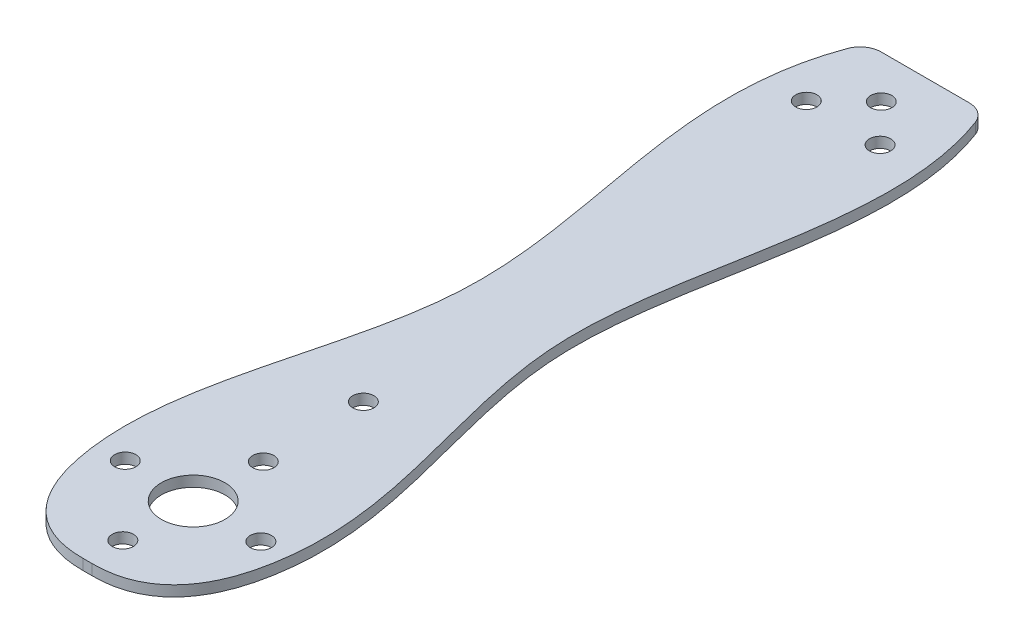
from build123d import *

# Parameters (mm, degrees)
BOSS_EXTRUDE2_DEPTH = 1.27
SKETCH2_R           = 1.27
CUT_EXTRUDE1_DEPTH  = 90.688856727
F_3DSKETCH1_R       = 1.27
F_3DSKETCH1_R_2     = 3.81
CUT_EXTRUDE8_DEPTH  = 81.499781524
SKETCH4_R           = 1.27
CUT_EXTRUDE9_DEPTH  = 90.688856727


with BuildPart() as part:
    # Sketch1 → Boss-Extrude2 (new body)
    with BuildSketch(Plane(origin=(0, 0, 0), x_dir=(1, 0, 0), z_dir=(0, 1, 0))):
        with BuildLine():
            Line((5.275230634, 88.9), (-5.274680514, 88.9))
            ThreePointArc((-5.274680514, 88.9), (-6.725107784, 88.445152449), (-7.656067895, 87.24351239))
            add(Edge.make_bspline(
                [(-0.552393074, -11.443610573), (-4.892105519, -11.469042984), (-9.529424716, -8.066777439), (-14.645892482, 10.818030103), (0.652997254, 38.831677118), (-11.939039637, 68.466563532), (-8.693878789, 84.446234394), (-7.656067895, 87.24351239)],
                knots=[0.003862343, 0.003862343, 0.003862343, 0.003862343, 0.0963537, 0.162148545, 0.527592198, 0.902665046, 0.983926161, 0.983926161, 0.983926161, 0.983926161], degree=3))
            ThreePointArc((-0.552393074, -11.443610573), (-0.003084566, -11.442371375), (0.546218602, -11.445092034))
            add(Edge.make_bspline(
                [(0.546218602, -11.445092034), (4.705642382, -11.480686299), (9.426948295, -8.185590673), (14.781899316, 10.725353159), (-0.687433656, 38.828061669), (11.938501934, 68.466384766), (8.694987433, 84.446805864), (7.656404014, 87.244088984)],
                knots=[0.003867531, 0.003867531, 0.003867531, 0.003867531, 0.093613613, 0.162313612, 0.527685277, 0.902684241, 0.983933931, 0.983933931, 0.983933931, 0.983933931], degree=3))
            ThreePointArc((7.656404014, 87.244088984), (6.725405447, 88.445328034), (5.275230634, 88.9))
        make_face()
    extrude(amount=BOSS_EXTRUDE2_DEPTH)

    # Sketch2 → Cut-Extrude1 (cut, through all)
    with BuildSketch(Plane(origin=(0, 1.27, 0), x_dir=(1, 0, 0), z_dir=(0, 1, 0))):
        with Locations((0, 21.59)):
            Circle(SKETCH2_R)
    extrude(amount=-CUT_EXTRUDE1_DEPTH, mode=Mode.SUBTRACT)

    # 3DSketch1 → Cut-Extrude8 (cut, through all)
    with BuildSketch(Plane(origin=(0.211318445, 3.81, -9.389591413), x_dir=(0, 0, 1), z_dir=(0, 1, 0))):
        Circle(F_3DSKETCH1_R)
        with Locations((8.173527212, -8.361759845)):
            Circle(F_3DSKETCH1_R)
        with Locations((8.292926567, -0.10762338)):
            Circle(F_3DSKETCH1_R_2)
        with Locations((8.436879495, 8.14612138)):
            Circle(F_3DSKETCH1_R)
        with Locations((16.585496287, -0.239915776)):
            Circle(F_3DSKETCH1_R)
    extrude(amount=-CUT_EXTRUDE8_DEPTH, mode=Mode.SUBTRACT)

    # Sketch4 → Cut-Extrude9 (cut, through all)
    with BuildSketch(Plane(origin=(0, 1.27, 0), x_dir=(1, 0, 0), z_dir=(0, 1, 0))):
        with Locations((-4.684725231, 79.336510379)):
            Circle(SKETCH4_R)
        with Locations((-0.123545977, 83.754444717)):
            Circle(SKETCH4_R)
        with Locations((4.294388361, 79.193265463)):
            Circle(SKETCH4_R)
    extrude(amount=-CUT_EXTRUDE9_DEPTH, mode=Mode.SUBTRACT)


solid = part.part
